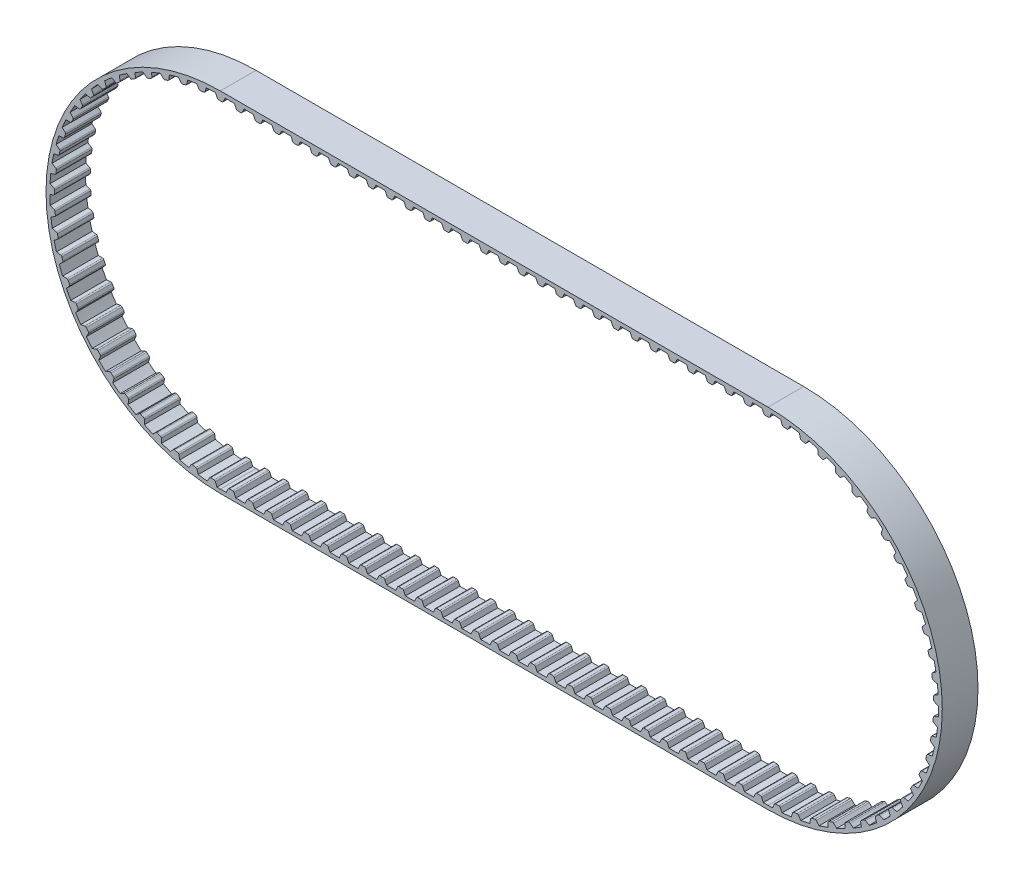
from build123d import *

# Parameters (mm, degrees)
BOSS_EXTRUDE1_DEPTH      = 4.7625
BOSS_EXTRUDE1_DEPTH_BACK = 4.7625
BOSS_EXTRUDE2_DEPTH      = 4.7625
FILLET1_R                = 0.396875
CRVPATTERN1_START        = -4.7625
CRVPATTERN1_DEPTH        = 9.525


# Read off the part's stored shape, not the designer's step: CrvPattern1
with BuildPart() as part:
    # Sketch4 → Boss-Extrude1 (new, two sides: drawn at the far end of the back side and taken through both)
    with BuildSketch(Plane.XY.offset(-BOSS_EXTRUDE1_DEPTH_BACK)):
        with BuildLine():
            Line((-73.025, -46.489158877), (73.025, -46.489158877))
            ThreePointArc((73.025, -46.489158877), (119.514158877, 0), (73.025, 46.489158877))
            Line((73.025, 46.489158877), (-73.025, 46.489158877))
            ThreePointArc((-73.025, 46.489158877), (-119.514158877, 0), (-73.025, -46.489158877))
        make_face()
        with BuildLine():
            Line((-73.025, -45.473158877), (73.025, -45.473158877))
            ThreePointArc((73.025, -45.473158877), (118.498158877, 0), (73.025, 45.473158877))
            Line((73.025, 45.473158877), (-73.025, 45.473158877))
            ThreePointArc((-73.025, 45.473158877), (-118.498158877, 0), (-73.025, -45.473158877))
        make_face(mode=Mode.SUBTRACT)
    extrude(amount=BOSS_EXTRUDE1_DEPTH + BOSS_EXTRUDE1_DEPTH_BACK)

    # Sketch5 → Boss-Extrude2 (add, symmetric)
    with BuildSketch(Plane.XY):
        Polygon((-74.3077, 45.473158877), (-73.715489274, 44.203158877), (-72.334510726, 44.203158877), (-71.7423, 45.473158877), align=None)
    extrude(amount=BOSS_EXTRUDE2_DEPTH, both=True)

    # Fillet1
    fillet1_edges = [part.edges().sort_by_distance(p)[0] for p in [
        (-73.715489274, 44.203158877, 0),
        (-72.334510726, 44.203158877, 0),
    ]]
    fillet(fillet1_edges, radius=FILLET1_R)

    # CrvPattern1 outline → CrvPattern1 (add)
    with BuildSketch(Plane.XY.offset(CRVPATTERN1_START)):
        with BuildLine():
            Line((-67.203167659, 44.432307255), (-66.717810576, 45.473158877))
            Line((-66.717810576, 45.473158877), (-69.283210576, 45.473158877))
            Line((-69.283210576, 45.473158877), (-68.797853494, 44.432307255))
            ThreePointArc((-68.797853494, 44.432307255), (-68.651403373, 44.265312897), (-68.438162591, 44.203158877))
            Line((-68.438162591, 44.203158877), (-67.562858562, 44.203158877))
            ThreePointArc((-67.562858562, 44.203158877), (-67.34961778, 44.265312897), (-67.203167659, 44.432307255))
        make_face()
        with BuildLine():
            Line((-62.178678235, 44.432307255), (-61.693321153, 45.473158877))
            Line((-61.693321153, 45.473158877), (-64.258721153, 45.473158877))
            Line((-64.258721153, 45.473158877), (-63.77336407, 44.432307255))
            ThreePointArc((-63.77336407, 44.432307255), (-63.626913949, 44.265312897), (-63.413673167, 44.203158877))
            Line((-63.413673167, 44.203158877), (-62.538369138, 44.203158877))
            ThreePointArc((-62.538369138, 44.203158877), (-62.325128356, 44.265312897), (-62.178678235, 44.432307255))
        make_face()
        with BuildLine():
            Line((-57.154188811, 44.432307255), (-56.668831729, 45.473158877))
            Line((-56.668831729, 45.473158877), (-59.234231729, 45.473158877))
            Line((-59.234231729, 45.473158877), (-58.748874646, 44.432307255))
            ThreePointArc((-58.748874646, 44.432307255), (-58.602424525, 44.265312897), (-58.389183743, 44.203158877))
            Line((-58.389183743, 44.203158877), (-57.513879714, 44.203158877))
            ThreePointArc((-57.513879714, 44.203158877), (-57.300638932, 44.265312897), (-57.154188811, 44.432307255))
        make_face()
        with BuildLine():
            Line((-52.129699388, 44.432307255), (-51.644342305, 45.473158877))
            Line((-51.644342305, 45.473158877), (-54.209742305, 45.473158877))
            Line((-54.209742305, 45.473158877), (-53.724385222, 44.432307255))
            ThreePointArc((-53.724385222, 44.432307255), (-53.577935102, 44.265312897), (-53.36469432, 44.203158877))
            Line((-53.36469432, 44.203158877), (-52.489390291, 44.203158877))
            ThreePointArc((-52.489390291, 44.203158877), (-52.276149509, 44.265312897), (-52.129699388, 44.432307255))
        make_face()
        with BuildLine():
            Line((-47.105209964, 44.432307255), (-46.619852881, 45.473158877))
            Line((-46.619852881, 45.473158877), (-49.185252881, 45.473158877))
            Line((-49.185252881, 45.473158877), (-48.699895799, 44.432307255))
            ThreePointArc((-48.699895799, 44.432307255), (-48.553445678, 44.265312897), (-48.340204896, 44.203158877))
            Line((-48.340204896, 44.203158877), (-47.464900867, 44.203158877))
            ThreePointArc((-47.464900867, 44.203158877), (-47.251660085, 44.265312897), (-47.105209964, 44.432307255))
        make_face()
        with BuildLine():
            Line((-42.08072054, 44.432307255), (-41.595363458, 45.473158877))
            Line((-41.595363458, 45.473158877), (-44.160763458, 45.473158877))
            Line((-44.160763458, 45.473158877), (-43.675406375, 44.432307255))
            ThreePointArc((-43.675406375, 44.432307255), (-43.528956254, 44.265312897), (-43.315715472, 44.203158877))
            Line((-43.315715472, 44.203158877), (-42.440411443, 44.203158877))
            ThreePointArc((-42.440411443, 44.203158877), (-42.227170661, 44.265312897), (-42.08072054, 44.432307255))
        make_face()
        with BuildLine():
            Line((-37.056231117, 44.432307255), (-36.570874034, 45.473158877))
            Line((-36.570874034, 45.473158877), (-39.136274034, 45.473158877))
            Line((-39.136274034, 45.473158877), (-38.650916951, 44.432307255))
            ThreePointArc((-38.650916951, 44.432307255), (-38.50446683, 44.265312897), (-38.291226048, 44.203158877))
            Line((-38.291226048, 44.203158877), (-37.41592202, 44.203158877))
            ThreePointArc((-37.41592202, 44.203158877), (-37.202681238, 44.265312897), (-37.056231117, 44.432307255))
        make_face()
        with BuildLine():
            Line((-32.031741693, 44.432307255), (-31.54638461, 45.473158877))
            Line((-31.54638461, 45.473158877), (-34.11178461, 45.473158877))
            Line((-34.11178461, 45.473158877), (-33.626427528, 44.432307255))
            ThreePointArc((-33.626427528, 44.432307255), (-33.479977407, 44.265312897), (-33.266736625, 44.203158877))
            Line((-33.266736625, 44.203158877), (-32.391432596, 44.203158877))
            ThreePointArc((-32.391432596, 44.203158877), (-32.178191814, 44.265312897), (-32.031741693, 44.432307255))
        make_face()
        with BuildLine():
            Line((-27.007252269, 44.432307255), (-26.521895187, 45.473158877))
            Line((-26.521895187, 45.473158877), (-29.087295187, 45.473158877))
            Line((-29.087295187, 45.473158877), (-28.601938104, 44.432307255))
            ThreePointArc((-28.601938104, 44.432307255), (-28.455487983, 44.265312897), (-28.242247201, 44.203158877))
            Line((-28.242247201, 44.203158877), (-27.366943172, 44.203158877))
            ThreePointArc((-27.366943172, 44.203158877), (-27.15370239, 44.265312897), (-27.007252269, 44.432307255))
        make_face()
        with BuildLine():
            Line((-21.982762845, 44.432307255), (-21.497405763, 45.473158877))
            Line((-21.497405763, 45.473158877), (-24.062805763, 45.473158877))
            Line((-24.062805763, 45.473158877), (-23.57744868, 44.432307255))
            ThreePointArc((-23.57744868, 44.432307255), (-23.430998559, 44.265312897), (-23.217757777, 44.203158877))
            Line((-23.217757777, 44.203158877), (-22.342453748, 44.203158877))
            ThreePointArc((-22.342453748, 44.203158877), (-22.129212966, 44.265312897), (-21.982762845, 44.432307255))
        make_face()
        with BuildLine():
            Line((-16.958273422, 44.432307255), (-16.472916339, 45.473158877))
            Line((-16.472916339, 45.473158877), (-19.038316339, 45.473158877))
            Line((-19.038316339, 45.473158877), (-18.552959256, 44.432307255))
            ThreePointArc((-18.552959256, 44.432307255), (-18.406509136, 44.265312897), (-18.193268353, 44.203158877))
            Line((-18.193268353, 44.203158877), (-17.317964325, 44.203158877))
            ThreePointArc((-17.317964325, 44.203158877), (-17.104723543, 44.265312897), (-16.958273422, 44.432307255))
        make_face()
        with BuildLine():
            Line((-11.933783998, 44.432307255), (-11.448426915, 45.473158877))
            Line((-11.448426915, 45.473158877), (-14.013826915, 45.473158877))
            Line((-14.013826915, 45.473158877), (-13.528469833, 44.432307255))
            ThreePointArc((-13.528469833, 44.432307255), (-13.382019712, 44.265312897), (-13.16877893, 44.203158877))
            Line((-13.16877893, 44.203158877), (-12.293474901, 44.203158877))
            ThreePointArc((-12.293474901, 44.203158877), (-12.080234119, 44.265312897), (-11.933783998, 44.432307255))
        make_face()
        with BuildLine():
            Line((-6.909294574, 44.432307255), (-6.423937492, 45.473158877))
            Line((-6.423937492, 45.473158877), (-8.989337492, 45.473158877))
            Line((-8.989337492, 45.473158877), (-8.503980409, 44.432307255))
            ThreePointArc((-8.503980409, 44.432307255), (-8.357530288, 44.265312897), (-8.144289506, 44.203158877))
            Line((-8.144289506, 44.203158877), (-7.268985477, 44.203158877))
            ThreePointArc((-7.268985477, 44.203158877), (-7.055744695, 44.265312897), (-6.909294574, 44.432307255))
        make_face()
        with BuildLine():
            Line((-1.884805151, 44.432307255), (-1.399448068, 45.473158877))
            Line((-1.399448068, 45.473158877), (-3.964848068, 45.473158877))
            Line((-3.964848068, 45.473158877), (-3.479490985, 44.432307255))
            ThreePointArc((-3.479490985, 44.432307255), (-3.333040864, 44.265312897), (-3.119800082, 44.203158877))
            Line((-3.119800082, 44.203158877), (-2.244496054, 44.203158877))
            ThreePointArc((-2.244496054, 44.203158877), (-2.031255271, 44.265312897), (-1.884805151, 44.432307255))
        make_face()
        with BuildLine():
            Line((3.139684273, 44.432307255), (3.625041356, 45.473158877))
            Line((3.625041356, 45.473158877), (1.059641356, 45.473158877))
            Line((1.059641356, 45.473158877), (1.544998438, 44.432307255))
            ThreePointArc((1.544998438, 44.432307255), (1.691448559, 44.265312897), (1.904689341, 44.203158877))
            Line((1.904689341, 44.203158877), (2.77999337, 44.203158877))
            ThreePointArc((2.77999337, 44.203158877), (2.993234152, 44.265312897), (3.139684273, 44.432307255))
        make_face()
        with BuildLine():
            Line((8.164173697, 44.432307255), (8.64953078, 45.473158877))
            Line((8.64953078, 45.473158877), (6.08413078, 45.473158877))
            Line((6.08413078, 45.473158877), (6.569487862, 44.432307255))
            ThreePointArc((6.569487862, 44.432307255), (6.715937983, 44.265312897), (6.929178765, 44.203158877))
            Line((6.929178765, 44.203158877), (7.804482794, 44.203158877))
            ThreePointArc((7.804482794, 44.203158877), (8.017723576, 44.265312897), (8.164173697, 44.432307255))
        make_face()
        with BuildLine():
            Line((13.188663121, 44.432307255), (13.674020203, 45.473158877))
            Line((13.674020203, 45.473158877), (11.108620203, 45.473158877))
            Line((11.108620203, 45.473158877), (11.593977286, 44.432307255))
            ThreePointArc((11.593977286, 44.432307255), (11.740427407, 44.265312897), (11.953668189, 44.203158877))
            Line((11.953668189, 44.203158877), (12.828972218, 44.203158877))
            ThreePointArc((12.828972218, 44.203158877), (13.042213, 44.265312897), (13.188663121, 44.432307255))
        make_face()
        with BuildLine():
            Line((18.213152544, 44.432307255), (18.698509627, 45.473158877))
            Line((18.698509627, 45.473158877), (16.133109627, 45.473158877))
            Line((16.133109627, 45.473158877), (16.61846671, 44.432307255))
            ThreePointArc((16.61846671, 44.432307255), (16.764916831, 44.265312897), (16.978157613, 44.203158877))
            Line((16.978157613, 44.203158877), (17.853461641, 44.203158877))
            ThreePointArc((17.853461641, 44.203158877), (18.066702423, 44.265312897), (18.213152544, 44.432307255))
        make_face()
        with BuildLine():
            Line((23.237641968, 44.432307255), (23.722999051, 45.473158877))
            Line((23.722999051, 45.473158877), (21.157599051, 45.473158877))
            Line((21.157599051, 45.473158877), (21.642956133, 44.432307255))
            ThreePointArc((21.642956133, 44.432307255), (21.789406254, 44.265312897), (22.002647036, 44.203158877))
            Line((22.002647036, 44.203158877), (22.877951065, 44.203158877))
            ThreePointArc((22.877951065, 44.203158877), (23.091191847, 44.265312897), (23.237641968, 44.432307255))
        make_face()
        with BuildLine():
            Line((28.262131392, 44.432307255), (28.747488474, 45.473158877))
            Line((28.747488474, 45.473158877), (26.182088474, 45.473158877))
            Line((26.182088474, 45.473158877), (26.667445557, 44.432307255))
            ThreePointArc((26.667445557, 44.432307255), (26.813895678, 44.265312897), (27.02713646, 44.203158877))
            Line((27.02713646, 44.203158877), (27.902440489, 44.203158877))
            ThreePointArc((27.902440489, 44.203158877), (28.115681271, 44.265312897), (28.262131392, 44.432307255))
        make_face()
        with BuildLine():
            Line((33.286620816, 44.432307255), (33.771977898, 45.473158877))
            Line((33.771977898, 45.473158877), (31.206577898, 45.473158877))
            Line((31.206577898, 45.473158877), (31.691934981, 44.432307255))
            ThreePointArc((31.691934981, 44.432307255), (31.838385102, 44.265312897), (32.051625884, 44.203158877))
            Line((32.051625884, 44.203158877), (32.926929913, 44.203158877))
            ThreePointArc((32.926929913, 44.203158877), (33.140170695, 44.265312897), (33.286620816, 44.432307255))
        make_face()
        with BuildLine():
            Line((38.311110239, 44.432307255), (38.796467322, 45.473158877))
            Line((38.796467322, 45.473158877), (36.231067322, 45.473158877))
            Line((36.231067322, 45.473158877), (36.716424404, 44.432307255))
            ThreePointArc((36.716424404, 44.432307255), (36.862874525, 44.265312897), (37.076115307, 44.203158877))
            Line((37.076115307, 44.203158877), (37.951419336, 44.203158877))
            ThreePointArc((37.951419336, 44.203158877), (38.164660118, 44.265312897), (38.311110239, 44.432307255))
        make_face()
        with BuildLine():
            Line((43.335599663, 44.432307255), (43.820956746, 45.473158877))
            Line((43.820956746, 45.473158877), (41.255556746, 45.473158877))
            Line((41.255556746, 45.473158877), (41.740913828, 44.432307255))
            ThreePointArc((41.740913828, 44.432307255), (41.887363949, 44.265312897), (42.100604731, 44.203158877))
            Line((42.100604731, 44.203158877), (42.97590876, 44.203158877))
            ThreePointArc((42.97590876, 44.203158877), (43.189149542, 44.265312897), (43.335599663, 44.432307255))
        make_face()
        with BuildLine():
            Line((48.360089087, 44.432307255), (48.845446169, 45.473158877))
            Line((48.845446169, 45.473158877), (46.280046169, 45.473158877))
            Line((46.280046169, 45.473158877), (46.765403252, 44.432307255))
            ThreePointArc((46.765403252, 44.432307255), (46.911853373, 44.265312897), (47.125094155, 44.203158877))
            Line((47.125094155, 44.203158877), (48.000398184, 44.203158877))
            ThreePointArc((48.000398184, 44.203158877), (48.213638966, 44.265312897), (48.360089087, 44.432307255))
        make_face()
        with BuildLine():
            Line((53.38457851, 44.432307255), (53.869935593, 45.473158877))
            Line((53.869935593, 45.473158877), (51.304535593, 45.473158877))
            Line((51.304535593, 45.473158877), (51.789892676, 44.432307255))
            ThreePointArc((51.789892676, 44.432307255), (51.936342797, 44.265312897), (52.149583579, 44.203158877))
            Line((52.149583579, 44.203158877), (53.024887607, 44.203158877))
            ThreePointArc((53.024887607, 44.203158877), (53.238128389, 44.265312897), (53.38457851, 44.432307255))
        make_face()
        with BuildLine():
            Line((58.409067934, 44.432307255), (58.894425017, 45.473158877))
            Line((58.894425017, 45.473158877), (56.329025017, 45.473158877))
            Line((56.329025017, 45.473158877), (56.814382099, 44.432307255))
            ThreePointArc((56.814382099, 44.432307255), (56.96083222, 44.265312897), (57.174073002, 44.203158877))
            Line((57.174073002, 44.203158877), (58.049377031, 44.203158877))
            ThreePointArc((58.049377031, 44.203158877), (58.262617813, 44.265312897), (58.409067934, 44.432307255))
        make_face()
        with BuildLine():
            Line((63.433557358, 44.432307255), (63.91891444, 45.473158877))
            Line((63.91891444, 45.473158877), (61.35351444, 45.473158877))
            Line((61.35351444, 45.473158877), (61.838871523, 44.432307255))
            ThreePointArc((61.838871523, 44.432307255), (61.985321644, 44.265312897), (62.198562426, 44.203158877))
            Line((62.198562426, 44.203158877), (63.073866455, 44.203158877))
            ThreePointArc((63.073866455, 44.203158877), (63.287107237, 44.265312897), (63.433557358, 44.432307255))
        make_face()
        with BuildLine():
            Line((68.458046782, 44.432307255), (68.943403864, 45.473158877))
            Line((68.943403864, 45.473158877), (66.378003864, 45.473158877))
            Line((66.378003864, 45.473158877), (66.863360947, 44.432307255))
            ThreePointArc((66.863360947, 44.432307255), (67.009811068, 44.265312897), (67.22305185, 44.203158877))
            Line((67.22305185, 44.203158877), (68.098355879, 44.203158877))
            ThreePointArc((68.098355879, 44.203158877), (68.311596661, 44.265312897), (68.458046782, 44.432307255))
        make_face()
        with BuildLine():
            ThreePointArc((-76.770702203, 45.318626339), (-78.039271817, 45.195854416), (-79.30390253, 45.037579434))
            Line((-79.30390253, 45.037579434), (-78.716978891, 44.073428049))
            ThreePointArc((-78.716978891, 44.073428049), (-78.553007581, 43.92360094), (-78.334213533, 43.885339758))
            Line((-78.334213533, 43.885339758), (-77.464247284, 43.981858505))
            ThreePointArc((-77.464247284, 43.981858505), (-77.259160538, 44.067147308), (-77.132017771, 44.249272183))
            Line((-77.132017771, 44.249272183), (-76.770702203, 45.318626339))
        make_face()
        with BuildLine():
            ThreePointArc((-81.745091853, 44.629230067), (-82.992387559, 44.36732315), (-84.231853503, 44.070564017))
            Line((-84.231853503, 44.070564017), (-83.542193202, 43.177011601))
            ThreePointArc((-83.542193202, 43.177011601), (-83.362700562, 43.046179092), (-83.141021749, 43.032277397))
            Line((-83.141021749, 43.032277397), (-82.287003738, 43.22413771))
            ThreePointArc((-82.287003738, 43.22413771), (-82.092572348, 43.331521079), (-81.98628762, 43.526555204))
            Line((-81.98628762, 43.526555204), (-81.745091853, 44.629230067))
        make_face()
        with BuildLine():
            ThreePointArc((-86.613127759, 43.395517767), (-87.823937037, 42.997670179), (-89.023121188, 42.566046289))
            Line((-89.023121188, 42.566046289), (-88.239135598, 41.753990967))
            ThreePointArc((-88.239135598, 41.753990967), (-88.046310794, 41.643748743), (-87.824450899, 41.654376086))
            Line((-87.824450899, 41.654376086), (-86.996797073, 41.939237959))
            ThreePointArc((-86.996797073, 41.939237959), (-86.815392402, 42.067406203), (-86.731262003, 42.272970863))
            Line((-86.731262003, 42.272970863), (-86.613127759, 43.395517767))
        make_face()
        with BuildLine():
            ThreePointArc((-91.315437397, 41.632536292), (-92.47499273, 41.103600342), (-93.619269356, 40.542375953))
            Line((-93.619269356, 40.542375953), (-92.750520282, 39.821721878))
            ThreePointArc((-92.750520282, 39.821721878), (-92.546715081, 39.733414497), (-92.327379997, 39.768441263))
            Line((-92.327379997, 39.768441263), (-91.536184754, 40.142830406))
            ThreePointArc((-91.536184754, 40.142830406), (-91.370019288, 40.290220335), (-91.309069306, 40.50380838))
            Line((-91.309069306, 40.50380838), (-91.315437397, 41.632536292))
        make_face()
        with BuildLine():
            ThreePointArc((-95.79466951, 39.361787671), (-96.888828496, 38.708214474), (-97.964241539, 38.024234505))
            Line((-97.964241539, 38.024234505), (-97.021324592, 37.403771063))
            ThreePointArc((-97.021324592, 37.403771063), (-96.809024685, 37.338475559), (-96.594889511, 37.397474546))
            Line((-96.594889511, 37.397474546), (-95.849802587, 37.85682476))
            ThreePointArc((-95.849802587, 37.85682476), (-95.700902945, 38.021638746), (-95.663876752, 38.240645171))
            Line((-95.663876752, 38.240645171), (-95.79466951, 39.361787671))
        make_face()
        with BuildLine():
            ThreePointArc((-99.996193582, 36.610966868), (-101.011611417, 35.840727666), (-102.005044708, 35.042334212))
            Line((-102.005044708, 35.042334212), (-100.999460083, 34.529628824))
            ThreePointArc((-100.999460083, 34.529628824), (-100.781254765, 34.488141566), (-100.574931179, 34.5703932))
            Line((-100.574931179, 34.5703932), (-99.885039954, 35.109102063))
            ThreePointArc((-99.885039954, 35.109102063), (-99.755222177, 35.289329969), (-99.742571358, 35.511083684))
            Line((-99.742571358, 35.511083684), (-99.996193582, 36.610966868))
        make_face()
        with BuildLine():
            ThreePointArc((-103.868766137, 33.413623999), (-104.793058378, 32.536112938), (-105.692395604, 31.633043526))
            Line((-105.692395604, 31.633043526), (-104.636407816, 31.234349354))
            ThreePointArc((-104.636407816, 31.234349354), (-104.414958407, 31.217176338), (-104.218962815, 31.321677444))
            Line((-104.218962815, 31.321677444), (-103.592681478, 31.933174648))
            ThreePointArc((-103.592681478, 31.933174648), (-103.483528875, 32.126618342), (-103.495407725, 32.348414749))
            Line((-103.495407725, 32.348414749), (-103.868766137, 33.413623999))
        make_face()
        with BuildLine():
            ThreePointArc((-107.365155723, 29.808755143), (-108.187049331, 28.834674701), (-108.981321815, 27.837943527))
            Line((-108.981321815, 27.837943527), (-107.887810114, 27.558123206))
            ThreePointArc((-107.887810114, 27.558123206), (-107.6658175, 27.565473881), (-107.482540342, 27.690949922))
            Line((-107.482540342, 27.690949922), (-106.927507273, 28.3677774))
            ThreePointArc((-106.927507273, 28.3677774), (-106.840351114, 28.572077565), (-106.876614754, 28.791211546))
            Line((-106.876614754, 28.791211546), (-107.365155723, 29.808755143))
        make_face()
        with BuildLine():
            ThreePointArc((-110.442718969, 25.840326728), (-111.152189798, 24.781557181), (-111.831710273, 23.703320781))
            Line((-111.831710273, 23.703320781), (-110.714011568, 23.545787111))
            ThreePointArc((-110.714011568, 23.545787111), (-110.49418326, 23.577571825), (-110.325859859, 23.722492445))
            Line((-110.325859859, 23.722492445), (-109.848844464, 24.456395337))
            ThreePointArc((-109.848844464, 24.456395337), (-109.78474774, 24.669060246), (-109.844953883, 24.882859155))
            Line((-109.844953883, 24.882859155), (-110.442718969, 25.840326728))
        make_face()
        with BuildLine():
            ThreePointArc((-113.063920676, 21.556739303), (-113.652315735, 20.426193831), (-114.208796496, 19.279602808))
            Line((-114.208796496, 19.279602808), (-113.08054269, 19.246277133))
            ThreePointArc((-113.08054269, 19.246277133), (-112.865559802, 19.302108227), (-112.714243097, 19.464705915))
            Line((-112.714243097, 19.464705915), (-112.321063248, 20.246733248))
            ThreePointArc((-112.321063248, 20.246733248), (-112.280807708, 20.465169154), (-112.364222057, 20.671025414))
            Line((-112.364222057, 20.671025414), (-113.063920676, 21.556739303))
        make_face()
        with BuildLine():
            ThreePointArc((-115.196791614, 17.010237221), (-115.656934601, 15.821704411), (-116.083588584, 14.620743051))
            Line((-116.083588584, 14.620743051), (-114.958540314, 14.712031824))
            ThreePointArc((-114.958540314, 14.712031824), (-114.751024864, 14.791228359), (-114.618560375, 14.96952001))
            Line((-114.618560375, 14.96952001), (-114.314011451, 15.790133863))
            ThreePointArc((-114.314011451, 15.790133863), (-114.298088068, 16.011676634), (-114.403693268, 16.207079538))
            Line((-114.403693268, 16.207079538), (-115.196791614, 17.010237221))
        make_face()
        with BuildLine():
            ThreePointArc((-116.815318432, 12.25627145), (-117.141597257, 11.024247125), (-117.433220821, 9.783562835))
            Line((-117.433220821, 9.783562835), (-116.325099627, 9.998352663))
            ThreePointArc((-116.325099627, 9.998352663), (-116.127582556, 10.099948726), (-116.015585874, 10.291759822))
            Line((-116.015585874, 10.291759822), (-115.803382276, 11.140951659))
            ThreePointArc((-115.803382276, 11.140951659), (-115.811985258, 11.36289927), (-115.938493305, 11.545465607))
            Line((-115.938493305, 11.545465607), (-116.815318432, 12.25627145))
        make_face()
        with BuildLine():
            ThreePointArc((-117.899760927, 7.352823266), (-118.088196163, 6.09233369), (-118.241232549, 4.827058354))
            Line((-118.241232549, 4.827058354), (-117.163553522, 5.162729573))
            ThreePointArc((-117.163553522, 5.162729573), (-116.978443829, 5.285486059), (-116.888280909, 5.488477194))
            Line((-116.888280909, 5.488477194), (-116.771010758, 6.35588993))
            ThreePointArc((-116.771010758, 6.35588993), (-116.80403518, 6.575535419), (-116.94990313, 6.743038537))
            Line((-116.94990313, 6.743038537), (-117.899760927, 7.352823266))
        make_face()
        with BuildLine():
            ThreePointArc((-118.436892802, 2.359697095), (-118.485186217, 1.086115705), (-118.497768931, -0.18831887))
            Line((-118.497768931, -0.18831887), (-117.463675879, 0.264139759))
            ThreePointArc((-117.463675879, 0.264139759), (-117.293231235, 0.406559479), (-117.226001741, 0.618254894))
            Line((-117.226001741, 0.618254894), (-117.20509531, 1.493309214))
            ThreePointArc((-117.20509531, 1.493309214), (-117.262138393, 1.707973697), (-117.425587183, 1.858370659))
            Line((-117.425587183, 1.858370659), (-118.436892802, 2.359697095))
        make_face()
        with BuildLine():
            ThreePointArc((-118.420162981, -2.662208891), (-118.327725569, -3.933348983), (-118.199701147, -5.201399281))
            Line((-118.199701147, -5.201399281), (-117.221806284, -4.63767161))
            ThreePointArc((-117.221806284, -4.63767161), (-117.068105502, -4.477325663), (-117.024629391, -4.259507893))
            Line((-117.024629391, -4.259507893), (-117.100341664, -3.387484502))
            ThreePointArc((-117.100341664, -3.387484502), (-117.180707686, -3.18041916), (-117.359743829, -3.048962655))
            Line((-117.359743829, -3.048962655), (-118.420162981, -2.662208891))
        make_face()
        with BuildLine():
            ThreePointArc((-117.849775507, -7.651645507), (-117.617734673, -8.904840967), (-117.350664552, -10.151041337))
            Line((-117.350664552, -10.151041337), (-116.440894677, -9.482920072))
            ThreePointArc((-116.440894677, -9.482920072), (-116.305812352, -9.306603542), (-116.286619877, -9.085320009))
            Line((-116.286619877, -9.085320009), (-116.458027436, -8.226963095))
            ThreePointArc((-116.458027436, -8.226963095), (-116.560736222, -8.030022346), (-116.753176122, -7.919109594))
            Line((-116.753176122, -7.919109594), (-117.849775507, -7.651645507))
        make_face()
        with BuildLine():
            ThreePointArc((-116.732687056, -12.547759579), (-116.363872862, -13.767725931), (-115.961014338, -14.976877212))
            Line((-115.961014338, -14.976877212), (-115.130465369, -14.21251103))
            ThreePointArc((-115.130465369, -14.21251103), (-115.015649019, -14.022374344), (-115.020974259, -13.80032391))
            Line((-115.020974259, -13.80032391), (-115.285986549, -12.96610234))
            ThreePointArc((-115.285986549, -12.96610234), (-115.409785422, -12.781688152), (-115.613282003, -12.69267189))
            Line((-115.613282003, -12.69267189), (-116.732687056, -12.547759579))
        make_face()
        with BuildLine():
            ThreePointArc((-115.082522087, -17.290836132), (-114.581432739, -18.462694176), (-114.047699236, -19.620049074))
            Line((-114.047699236, -19.620049074), (-113.306500882, -18.768760491))
            ThreePointArc((-113.306500882, -18.768760491), (-113.213350855, -18.567122633), (-113.243128861, -18.347013515))
            Line((-113.243128861, -18.347013515), (-113.598513686, -17.547101789))
            ThreePointArc((-113.598513686, -17.547101789), (-113.741892744, -17.377463353), (-113.95396408, -17.311429259))
            Line((-113.95396408, -17.311429259), (-115.082522087, -17.290836132))
        make_face()
        with BuildLine():
            ThreePointArc((-112.919406675, -21.823026699), (-112.292153661, -22.932483983), (-111.634054807, -24.023926931))
            Line((-111.634054807, -24.023926931), (-110.991247022, -23.096098605))
            ThreePointArc((-110.991247022, -23.096098605), (-110.920899412, -22.885418831), (-110.974766999, -22.669935569))
            Line((-110.974766999, -22.669935569), (-111.416189942, -21.914089733))
            ThreePointArc((-111.416189942, -21.914089733), (-111.577400477, -21.761296026), (-111.795460062, -21.719049479))
            Line((-111.795460062, -21.719049479), (-112.919406675, -21.823026699))
        make_face()
        with BuildLine():
            ThreePointArc((-110.269723045, -26.089054861), (-109.523956594, -27.122579998), (-108.749518828, -28.13479932))
            Line((-108.749518828, -28.13479932), (-108.212941553, -27.141747419))
            ThreePointArc((-108.212941553, -27.141747419), (-108.166254348, -26.924595264), (-108.243554527, -26.716365977))
            Line((-108.243554527, -26.716365977), (-108.765631817, -26.01380463))
            ThreePointArc((-108.765631817, -26.01380463), (-108.94270764, -25.879719187), (-109.164095931, -25.861775442))
            Line((-109.164095931, -25.861775442), (-110.269723045, -26.089054861))
        make_face()
        with BuildLine():
            ThreePointArc((-107.165787805, -30.036890424), (-106.310603584, -30.981878127), (-105.429272258, -31.902528389))
            Line((-105.429272258, -31.902528389), (-105.005469807, -30.856364572))
            ThreePointArc((-105.005469807, -30.856364572), (-104.983012423, -30.635388511), (-105.082802409, -30.436952849))
            Line((-105.082802409, -30.436952849), (-105.679166581, -29.796244712))
            ThreePointArc((-105.679166581, -29.796244712), (-105.869948004, -29.682502891), (-106.091964861, -29.689080797))
            Line((-106.091964861, -29.689080797), (-107.165787805, -30.036890424))
        make_face()
        with BuildLine():
            ThreePointArc((-103.645457794, -33.618384), (-102.691285975, -34.463308818), (-101.713810162, -35.2811614))
            Line((-101.713810162, -35.2811614), (-101.407951398, -34.194645101))
            ThreePointArc((-101.407951398, -34.194645101), (-101.409997735, -33.972540248), (-101.531060448, -33.786318411))
            Line((-101.531060448, -33.786318411), (-102.194438005, -33.215277817))
            ThreePointArc((-102.194438005, -33.215277817), (-102.396598182, -33.123266861), (-102.616535797, -33.154286191))
            Line((-102.616535797, -33.154286191), (-103.645457794, -33.618384))
        make_face()
        with BuildLine():
            ThreePointArc((-99.751668373, -36.789854253), (-98.710146418, -37.524411144), (-97.648447806, -38.229491187))
            Line((-97.648447806, -38.229491187), (-97.464263107, -37.115873996))
            ThreePointArc((-97.464263107, -37.115873996), (-97.490788205, -36.89534923), (-97.631647117, -36.723612454))
            Line((-97.631647117, -36.723612454), (-98.35394724, -36.229204045))
            ThreePointArc((-98.35394724, -36.229204045), (-98.565020544, -36.160046155), (-98.78019647, -36.215128586))
            Line((-98.78019647, -36.215128586), (-99.751668373, -36.789854253))
        make_face()
        with BuildLine():
            ThreePointArc((-95.531909764, -39.512620656), (-94.415740493, -40.12785067), (-93.282767984, -40.711558734))
            Line((-93.282767984, -40.711558734), (-93.22250374, -39.584422774))
            ThreePointArc((-93.22250374, -39.584422774), (-93.27318409, -39.368167704), (-93.432121228, -39.21301056))
            Line((-93.432121228, -39.21301056), (-94.204534455, -38.801264339))
            ThreePointArc((-94.204534455, -38.801264339), (-94.42194655, -38.755802993), (-94.629736415, -38.834276717))
            Line((-94.629736415, -38.834276717), (-95.531909764, -39.512620656))
        make_face()
        with BuildLine():
            ThreePointArc((-91.037647837, -41.753475258), (-89.8604445, -42.241874801), (-88.670016282, -42.697091749))
            Line((-88.670016282, -42.697091749), (-88.734407499, -41.570184023))
            ThreePointArc((-88.734407499, -41.570184023), (-88.808624983, -41.360836182), (-88.983701887, -41.224151029))
            Line((-88.983701887, -41.224151029), (-89.796807555, -40.900088818))
            ThreePointArc((-89.796807555, -40.900088818), (-90.017906797, -40.878878481), (-90.215776312, -40.979786401))
            Line((-90.215776312, -40.979786401), (-91.037647837, -41.753475258))
        make_face()
        with BuildLine():
            ThreePointArc((-86.323696417, -43.485087695), (-85.099816659, -43.84070005), (-83.866451674, -44.161873872))
            Line((-83.866451674, -44.161873872), (-84.054713012, -43.0489386))
            ThreePointArc((-84.054713012, -43.0489386), (-84.151562443, -42.849051279), (-84.340643804, -42.732505184))
            Line((-84.340643804, -42.732505184), (-85.184524949, -42.500079377))
            ThreePointArc((-85.184524949, -42.500079377), (-85.406614723, -42.503378738), (-85.592150592, -42.62549014))
            Line((-85.592150592, -42.62549014), (-86.323696417, -43.485087695))
        make_face()
        with BuildLine():
            ThreePointArc((-81.447548751, -44.686338525), (-80.191919501, -44.904826501), (-78.930660363, -45.088040032))
            Line((-78.930660363, -45.088040032), (-79.240495711, -44.00265102))
            ThreePointArc((-79.240495711, -44.00265102), (-79.358795875, -43.814662125), (-79.559575581, -43.719676531))
            Line((-79.559575581, -43.719676531), (-80.42393989, -43.581721886))
            ThreePointArc((-80.42393989, -43.581721886), (-80.644311499, -43.609490706), (-80.815250852, -43.75131627))
            Line((-80.815250852, -43.75131627), (-81.447548751, -44.686338525))
        make_face()
        with BuildLine():
            ThreePointArc((-76.468676296, -45.342576811), (-75.196611713, -45.421275641), (-73.922841246, -45.464294335))
            Line((-73.922841246, -45.464294335), (-74.350471727, -44.419689422))
            ThreePointArc((-74.350471727, -44.419689422), (-74.488779787, -44.245891742), (-74.698809048, -44.173625132))
            Line((-74.698809048, -44.173625132), (-75.573114386, -44.131824198))
            ThreePointArc((-75.573114386, -44.131824198), (-75.789080089, -44.183723797), (-75.943338082, -44.343533762))
            Line((-75.943338082, -44.343533762), (-76.468676296, -45.342576811))
        make_face()
        with BuildLine():
            Line((-71.455648576, -45.473158877), (-68.890248576, -45.473158877))
            Line((-68.890248576, -45.473158877), (-69.375605659, -44.432307255))
            ThreePointArc((-69.375605659, -44.432307255), (-69.52205578, -44.265312897), (-69.735296562, -44.203158877))
            Line((-69.735296562, -44.203158877), (-70.61060059, -44.203158877))
            ThreePointArc((-70.61060059, -44.203158877), (-70.823841372, -44.265312897), (-70.970291493, -44.432307255))
            Line((-70.970291493, -44.432307255), (-71.455648576, -45.473158877))
        make_face()
        with BuildLine():
            Line((-66.431159152, -45.473158877), (-63.865759152, -45.473158877))
            Line((-63.865759152, -45.473158877), (-64.351116235, -44.432307255))
            ThreePointArc((-64.351116235, -44.432307255), (-64.497566356, -44.265312897), (-64.710807138, -44.203158877))
            Line((-64.710807138, -44.203158877), (-65.586111167, -44.203158877))
            ThreePointArc((-65.586111167, -44.203158877), (-65.799351949, -44.265312897), (-65.94580207, -44.432307255))
            Line((-65.94580207, -44.432307255), (-66.431159152, -45.473158877))
        make_face()
        with BuildLine():
            Line((-61.406669729, -45.473158877), (-58.841269729, -45.473158877))
            Line((-58.841269729, -45.473158877), (-59.326626811, -44.432307255))
            ThreePointArc((-59.326626811, -44.432307255), (-59.473076932, -44.265312897), (-59.686317714, -44.203158877))
            Line((-59.686317714, -44.203158877), (-60.561621743, -44.203158877))
            ThreePointArc((-60.561621743, -44.203158877), (-60.774862525, -44.265312897), (-60.921312646, -44.432307255))
            Line((-60.921312646, -44.432307255), (-61.406669729, -45.473158877))
        make_face()
        with BuildLine():
            Line((-56.382180305, -45.473158877), (-53.816780305, -45.473158877))
            Line((-53.816780305, -45.473158877), (-54.302137388, -44.432307255))
            ThreePointArc((-54.302137388, -44.432307255), (-54.448587508, -44.265312897), (-54.66182829, -44.203158877))
            Line((-54.66182829, -44.203158877), (-55.537132319, -44.203158877))
            ThreePointArc((-55.537132319, -44.203158877), (-55.750373101, -44.265312897), (-55.896823222, -44.432307255))
            Line((-55.896823222, -44.432307255), (-56.382180305, -45.473158877))
        make_face()
        with BuildLine():
            Line((-51.357690881, -45.473158877), (-48.792290881, -45.473158877))
            Line((-48.792290881, -45.473158877), (-49.277647964, -44.432307255))
            ThreePointArc((-49.277647964, -44.432307255), (-49.424098085, -44.265312897), (-49.637338867, -44.203158877))
            Line((-49.637338867, -44.203158877), (-50.512642896, -44.203158877))
            ThreePointArc((-50.512642896, -44.203158877), (-50.725883678, -44.265312897), (-50.872333799, -44.432307255))
            Line((-50.872333799, -44.432307255), (-51.357690881, -45.473158877))
        make_face()
        with BuildLine():
            Line((-46.333201457, -45.473158877), (-43.767801457, -45.473158877))
            Line((-43.767801457, -45.473158877), (-44.25315854, -44.432307255))
            ThreePointArc((-44.25315854, -44.432307255), (-44.399608661, -44.265312897), (-44.612849443, -44.203158877))
            Line((-44.612849443, -44.203158877), (-45.488153472, -44.203158877))
            ThreePointArc((-45.488153472, -44.203158877), (-45.701394254, -44.265312897), (-45.847844375, -44.432307255))
            Line((-45.847844375, -44.432307255), (-46.333201457, -45.473158877))
        make_face()
        with BuildLine():
            Line((-41.308712034, -45.473158877), (-38.743312034, -45.473158877))
            Line((-38.743312034, -45.473158877), (-39.228669116, -44.432307255))
            ThreePointArc((-39.228669116, -44.432307255), (-39.375119237, -44.265312897), (-39.588360019, -44.203158877))
            Line((-39.588360019, -44.203158877), (-40.463664048, -44.203158877))
            ThreePointArc((-40.463664048, -44.203158877), (-40.67690483, -44.265312897), (-40.823354951, -44.432307255))
            Line((-40.823354951, -44.432307255), (-41.308712034, -45.473158877))
        make_face()
        with BuildLine():
            Line((-36.28422261, -45.473158877), (-33.71882261, -45.473158877))
            Line((-33.71882261, -45.473158877), (-34.204179693, -44.432307255))
            ThreePointArc((-34.204179693, -44.432307255), (-34.350629814, -44.265312897), (-34.563870596, -44.203158877))
            Line((-34.563870596, -44.203158877), (-35.439174624, -44.203158877))
            ThreePointArc((-35.439174624, -44.203158877), (-35.652415406, -44.265312897), (-35.798865527, -44.432307255))
            Line((-35.798865527, -44.432307255), (-36.28422261, -45.473158877))
        make_face()
        with BuildLine():
            Line((-31.259733186, -45.473158877), (-28.694333186, -45.473158877))
            Line((-28.694333186, -45.473158877), (-29.179690269, -44.432307255))
            ThreePointArc((-29.179690269, -44.432307255), (-29.32614039, -44.265312897), (-29.539381172, -44.203158877))
            Line((-29.539381172, -44.203158877), (-30.414685201, -44.203158877))
            ThreePointArc((-30.414685201, -44.203158877), (-30.627925983, -44.265312897), (-30.774376104, -44.432307255))
            Line((-30.774376104, -44.432307255), (-31.259733186, -45.473158877))
        make_face()
        with BuildLine():
            Line((-26.235243763, -45.473158877), (-23.669843763, -45.473158877))
            Line((-23.669843763, -45.473158877), (-24.155200845, -44.432307255))
            ThreePointArc((-24.155200845, -44.432307255), (-24.301650966, -44.265312897), (-24.514891748, -44.203158877))
            Line((-24.514891748, -44.203158877), (-25.390195777, -44.203158877))
            ThreePointArc((-25.390195777, -44.203158877), (-25.603436559, -44.265312897), (-25.74988668, -44.432307255))
            Line((-25.74988668, -44.432307255), (-26.235243763, -45.473158877))
        make_face()
        with BuildLine():
            Line((-21.210754339, -45.473158877), (-18.645354339, -45.473158877))
            Line((-18.645354339, -45.473158877), (-19.130711421, -44.432307255))
            ThreePointArc((-19.130711421, -44.432307255), (-19.277161542, -44.265312897), (-19.490402324, -44.203158877))
            Line((-19.490402324, -44.203158877), (-20.365706353, -44.203158877))
            ThreePointArc((-20.365706353, -44.203158877), (-20.578947135, -44.265312897), (-20.725397256, -44.432307255))
            Line((-20.725397256, -44.432307255), (-21.210754339, -45.473158877))
        make_face()
        with BuildLine():
            Line((-16.186264915, -45.473158877), (-13.620864915, -45.473158877))
            Line((-13.620864915, -45.473158877), (-14.106221998, -44.432307255))
            ThreePointArc((-14.106221998, -44.432307255), (-14.252672119, -44.265312897), (-14.465912901, -44.203158877))
            Line((-14.465912901, -44.203158877), (-15.34121693, -44.203158877))
            ThreePointArc((-15.34121693, -44.203158877), (-15.554457712, -44.265312897), (-15.700907832, -44.432307255))
            Line((-15.700907832, -44.432307255), (-16.186264915, -45.473158877))
        make_face()
        with BuildLine():
            Line((-11.161775491, -45.473158877), (-8.596375491, -45.473158877))
            Line((-8.596375491, -45.473158877), (-9.081732574, -44.432307255))
            ThreePointArc((-9.081732574, -44.432307255), (-9.228182695, -44.265312897), (-9.441423477, -44.203158877))
            Line((-9.441423477, -44.203158877), (-10.316727506, -44.203158877))
            ThreePointArc((-10.316727506, -44.203158877), (-10.529968288, -44.265312897), (-10.676418409, -44.432307255))
            Line((-10.676418409, -44.432307255), (-11.161775491, -45.473158877))
        make_face()
        with BuildLine():
            Line((-6.137286068, -45.473158877), (-3.571886068, -45.473158877))
            Line((-3.571886068, -45.473158877), (-4.05724315, -44.432307255))
            ThreePointArc((-4.05724315, -44.432307255), (-4.203693271, -44.265312897), (-4.416934053, -44.203158877))
            Line((-4.416934053, -44.203158877), (-5.292238082, -44.203158877))
            ThreePointArc((-5.292238082, -44.203158877), (-5.505478864, -44.265312897), (-5.651928985, -44.432307255))
            Line((-5.651928985, -44.432307255), (-6.137286068, -45.473158877))
        make_face()
        with BuildLine():
            Line((-1.112796644, -45.473158877), (1.452603356, -45.473158877))
            Line((1.452603356, -45.473158877), (0.967246273, -44.432307255))
            ThreePointArc((0.967246273, -44.432307255), (0.820796152, -44.265312897), (0.60755537, -44.203158877))
            Line((0.60755537, -44.203158877), (-0.267748658, -44.203158877))
            ThreePointArc((-0.267748658, -44.203158877), (-0.48098944, -44.265312897), (-0.627439561, -44.432307255))
            Line((-0.627439561, -44.432307255), (-1.112796644, -45.473158877))
        make_face()
        with BuildLine():
            Line((3.91169278, -45.473158877), (6.47709278, -45.473158877))
            Line((6.47709278, -45.473158877), (5.991735697, -44.432307255))
            ThreePointArc((5.991735697, -44.432307255), (5.845285576, -44.265312897), (5.632044794, -44.203158877))
            Line((5.632044794, -44.203158877), (4.756740765, -44.203158877))
            ThreePointArc((4.756740765, -44.203158877), (4.543499983, -44.265312897), (4.397049862, -44.432307255))
            Line((4.397049862, -44.432307255), (3.91169278, -45.473158877))
        make_face()
        with BuildLine():
            Line((8.936182203, -45.473158877), (11.501582203, -45.473158877))
            Line((11.501582203, -45.473158877), (11.016225121, -44.432307255))
            ThreePointArc((11.016225121, -44.432307255), (10.869775, -44.265312897), (10.656534218, -44.203158877))
            Line((10.656534218, -44.203158877), (9.781230189, -44.203158877))
            ThreePointArc((9.781230189, -44.203158877), (9.567989407, -44.265312897), (9.421539286, -44.432307255))
            Line((9.421539286, -44.432307255), (8.936182203, -45.473158877))
        make_face()
        with BuildLine():
            Line((13.960671627, -45.473158877), (16.526071627, -45.473158877))
            Line((16.526071627, -45.473158877), (16.040714545, -44.432307255))
            ThreePointArc((16.040714545, -44.432307255), (15.894264424, -44.265312897), (15.681023642, -44.203158877))
            Line((15.681023642, -44.203158877), (14.805719613, -44.203158877))
            ThreePointArc((14.805719613, -44.203158877), (14.592478831, -44.265312897), (14.44602871, -44.432307255))
            Line((14.44602871, -44.432307255), (13.960671627, -45.473158877))
        make_face()
        with BuildLine():
            Line((18.985161051, -45.473158877), (21.550561051, -45.473158877))
            Line((21.550561051, -45.473158877), (21.065203968, -44.432307255))
            ThreePointArc((21.065203968, -44.432307255), (20.918753847, -44.265312897), (20.705513065, -44.203158877))
            Line((20.705513065, -44.203158877), (19.830209037, -44.203158877))
            ThreePointArc((19.830209037, -44.203158877), (19.616968254, -44.265312897), (19.470518134, -44.432307255))
            Line((19.470518134, -44.432307255), (18.985161051, -45.473158877))
        make_face()
        with BuildLine():
            Line((24.009650475, -45.473158877), (26.575050475, -45.473158877))
            Line((26.575050475, -45.473158877), (26.089693392, -44.432307255))
            ThreePointArc((26.089693392, -44.432307255), (25.943243271, -44.265312897), (25.730002489, -44.203158877))
            Line((25.730002489, -44.203158877), (24.85469846, -44.203158877))
            ThreePointArc((24.85469846, -44.203158877), (24.641457678, -44.265312897), (24.495007557, -44.432307255))
            Line((24.495007557, -44.432307255), (24.009650475, -45.473158877))
        make_face()
        with BuildLine():
            Line((29.034139898, -45.473158877), (31.599539898, -45.473158877))
            Line((31.599539898, -45.473158877), (31.114182816, -44.432307255))
            ThreePointArc((31.114182816, -44.432307255), (30.967732695, -44.265312897), (30.754491913, -44.203158877))
            Line((30.754491913, -44.203158877), (29.879187884, -44.203158877))
            ThreePointArc((29.879187884, -44.203158877), (29.665947102, -44.265312897), (29.519496981, -44.432307255))
            Line((29.519496981, -44.432307255), (29.034139898, -45.473158877))
        make_face()
        with BuildLine():
            Line((34.058629322, -45.473158877), (36.624029322, -45.473158877))
            Line((36.624029322, -45.473158877), (36.138672239, -44.432307255))
            ThreePointArc((36.138672239, -44.432307255), (35.992222119, -44.265312897), (35.778981336, -44.203158877))
            Line((35.778981336, -44.203158877), (34.903677308, -44.203158877))
            ThreePointArc((34.903677308, -44.203158877), (34.690436526, -44.265312897), (34.543986405, -44.432307255))
            Line((34.543986405, -44.432307255), (34.058629322, -45.473158877))
        make_face()
        with BuildLine():
            Line((39.083118746, -45.473158877), (41.648518746, -45.473158877))
            Line((41.648518746, -45.473158877), (41.163161663, -44.432307255))
            ThreePointArc((41.163161663, -44.432307255), (41.016711542, -44.265312897), (40.80347076, -44.203158877))
            Line((40.80347076, -44.203158877), (39.928166731, -44.203158877))
            ThreePointArc((39.928166731, -44.203158877), (39.714925949, -44.265312897), (39.568475828, -44.432307255))
            Line((39.568475828, -44.432307255), (39.083118746, -45.473158877))
        make_face()
        with BuildLine():
            Line((44.10760817, -45.473158877), (46.67300817, -45.473158877))
            Line((46.67300817, -45.473158877), (46.187651087, -44.432307255))
            ThreePointArc((46.187651087, -44.432307255), (46.041200966, -44.265312897), (45.827960184, -44.203158877))
            Line((45.827960184, -44.203158877), (44.952656155, -44.203158877))
            ThreePointArc((44.952656155, -44.203158877), (44.739415373, -44.265312897), (44.592965252, -44.432307255))
            Line((44.592965252, -44.432307255), (44.10760817, -45.473158877))
        make_face()
        with BuildLine():
            Line((49.132097593, -45.473158877), (51.697497593, -45.473158877))
            Line((51.697497593, -45.473158877), (51.212140511, -44.432307255))
            ThreePointArc((51.212140511, -44.432307255), (51.06569039, -44.265312897), (50.852449608, -44.203158877))
            Line((50.852449608, -44.203158877), (49.977145579, -44.203158877))
            ThreePointArc((49.977145579, -44.203158877), (49.763904797, -44.265312897), (49.617454676, -44.432307255))
            Line((49.617454676, -44.432307255), (49.132097593, -45.473158877))
        make_face()
        with BuildLine():
            Line((54.156587017, -45.473158877), (56.721987017, -45.473158877))
            Line((56.721987017, -45.473158877), (56.236629934, -44.432307255))
            ThreePointArc((56.236629934, -44.432307255), (56.090179813, -44.265312897), (55.876939031, -44.203158877))
            Line((55.876939031, -44.203158877), (55.001635003, -44.203158877))
            ThreePointArc((55.001635003, -44.203158877), (54.788394221, -44.265312897), (54.6419441, -44.432307255))
            Line((54.6419441, -44.432307255), (54.156587017, -45.473158877))
        make_face()
        with BuildLine():
            Line((59.181076441, -45.473158877), (61.746476441, -45.473158877))
            Line((61.746476441, -45.473158877), (61.261119358, -44.432307255))
            ThreePointArc((61.261119358, -44.432307255), (61.114669237, -44.265312897), (60.901428455, -44.203158877))
            Line((60.901428455, -44.203158877), (60.026124426, -44.203158877))
            ThreePointArc((60.026124426, -44.203158877), (59.812883644, -44.265312897), (59.666433523, -44.432307255))
            Line((59.666433523, -44.432307255), (59.181076441, -45.473158877))
        make_face()
        with BuildLine():
            Line((64.205565864, -45.473158877), (66.770965864, -45.473158877))
            Line((66.770965864, -45.473158877), (66.285608782, -44.432307255))
            ThreePointArc((66.285608782, -44.432307255), (66.139158661, -44.265312897), (65.925917879, -44.203158877))
            Line((65.925917879, -44.203158877), (65.05061385, -44.203158877))
            ThreePointArc((65.05061385, -44.203158877), (64.837373068, -44.265312897), (64.690922947, -44.432307255))
            Line((64.690922947, -44.432307255), (64.205565864, -45.473158877))
        make_face()
        with BuildLine():
            Line((69.230055288, -45.473158877), (71.795455288, -45.473158877))
            Line((71.795455288, -45.473158877), (71.310098206, -44.432307255))
            ThreePointArc((71.310098206, -44.432307255), (71.163648085, -44.265312897), (70.950407303, -44.203158877))
            Line((70.950407303, -44.203158877), (70.075103274, -44.203158877))
            ThreePointArc((70.075103274, -44.203158877), (69.861862492, -44.265312897), (69.715412371, -44.432307255))
            Line((69.715412371, -44.432307255), (69.230055288, -45.473158877))
        make_face()
        with BuildLine():
            ThreePointArc((74.262553486, -45.456315729), (75.535966926, -45.403779835), (76.807407907, -45.31557755))
            Line((76.807407907, -45.31557755), (76.274618894, -44.320488047))
            ThreePointArc((76.274618894, -44.320488047), (76.119171009, -44.161835255), (75.90282351, -44.111550935))
            Line((75.90282351, -44.111550935), (75.028854945, -44.159884051))
            ThreePointArc((75.028854945, -44.159884051), (74.819371569, -44.233718112), (74.682366094, -44.408544463))
            Line((74.682366094, -44.408544463), (74.262553486, -45.456315729))
        make_face()
        with BuildLine():
            ThreePointArc((79.267421178, -45.042650411), (80.527276016, -44.850017088), (81.781237532, -44.622152375))
            Line((81.781237532, -44.622152375), (81.141970223, -43.691881146))
            ThreePointArc((81.141970223, -43.691881146), (80.969975834, -43.551336906), (80.749402872, -43.525215614))
            Line((80.749402872, -43.525215614), (79.886093579, -43.669625473))
            ThreePointArc((79.886093579, -43.669625473), (79.68602927, -43.766108764), (79.569137178, -43.954976422))
            Line((79.569137178, -43.954976422), (79.267421178, -45.042650411))
        make_face()
        with BuildLine():
            ThreePointArc((84.196153793, -44.079626827), (85.427084333, -43.749245507), (86.648272565, -43.384497495))
            Line((86.648272565, -43.384497495), (85.910323721, -42.530390503))
            ThreePointArc((85.910323721, -42.530390503), (85.72388054, -42.409668949), (85.501772312, -42.408029271))
            Line((85.501772312, -42.408029271), (84.659651558, -42.646754591))
            ThreePointArc((84.659651558, -42.646754591), (84.471446381, -42.764710365), (84.376093335, -42.965315823))
            Line((84.376093335, -42.965315823), (84.196153793, -44.079626827))
        make_face()
        with BuildLine():
            ThreePointArc((88.988638527, -42.578990397), (90.175631845, -42.114890544), (91.349152691, -41.617707847))
            Line((91.349152691, -41.617707847), (90.521522632, -40.850182123))
            ThreePointArc((90.521522632, -40.850182123), (90.322904595, -40.750755624), (90.101970023, -40.773617559))
            Line((90.101970023, -40.773617559), (89.291308651, -41.10374675))
            ThreePointArc((89.291308651, -41.10374675), (89.117258031, -41.24173637), (89.044606996, -41.451632964))
            Line((89.044606996, -41.451632964), (88.988638527, -42.578990397))
        make_face()
        with BuildLine():
            ThreePointArc((93.586424309, -40.559043488), (94.715003358, -39.96688545), (95.826544086, -39.343331907))
            Line((95.826544086, -39.343331907), (94.919326921, -38.671748504))
            ThreePointArc((94.919326921, -38.671748504), (94.710956453, -38.594829706), (94.493890143, -38.64191442))
            Line((94.493890143, -38.64191442), (93.724575305, -39.059421094))
            ThreePointArc((93.724575305, -39.059421094), (93.566802035, -39.215761583), (93.517739091, -39.43238933))
            Line((93.517739091, -39.43238933), (93.586424309, -40.559043488))
        make_face()
        with BuildLine():
            ThreePointArc((97.933434697, -38.044422183), (98.989834872, -37.331428158), (100.025838685, -36.589108879))
            Line((100.025838685, -36.589108879), (99.0500992, -36.021658698))
            ThreePointArc((99.0500992, -36.021658698), (98.834517671, -35.968185732), (98.623967051, -36.038918962))
            Line((98.623967051, -36.038918962), (97.90538162, -36.53871104))
            ThreePointArc((97.90538162, -36.53871104), (97.765809965, -36.711495606), (97.740933504, -36.932212427))
            Line((97.740933504, -36.932212427), (97.933434697, -38.044422183))
        make_face()
        with BuildLine():
            ThreePointArc((101.976651804, -35.065795814), (102.947988825, -34.240661764), (103.895820203, -33.388630374))
            Line((103.895820203, -33.388630374), (102.863458908, -32.932234265))
            ThreePointArc((102.863458908, -32.932234265), (102.643295639, -32.90285931), (102.441828669, -32.996378363))
            Line((102.441828669, -32.996378363), (101.782736801, -33.57236018))
            ThreePointArc((101.782736801, -33.57236018), (101.663069033, -33.759481474), (101.662682458, -33.981595417))
            Line((101.662682458, -33.981595417), (101.976651804, -35.065795814))
        make_face()
        with BuildLine():
            ThreePointArc((105.666762929, -31.659492907), (106.54118998, -30.732282498), (107.389288791, -29.780930714))
            Line((107.389288791, -29.780930714), (106.31289678, -29.441155067))
            ThreePointArc((106.31289678, -29.441155067), (106.090836968, -29.436236391), (105.90091082, -29.551400673))
            Line((105.90091082, -29.551400673), (105.309351066, -30.196547323))
            ThreePointArc((105.309351066, -30.196547323), (105.211046701, -30.395723138), (105.235154728, -30.616525213))
            Line((105.235154728, -30.616525213), (105.666762929, -31.659492907))
        make_face()
        with BuildLine():
            ThreePointArc((108.958761995, -27.8670581), (109.725614211, -26.849079962), (110.463636701, -25.810010853))
            Line((110.463636701, -25.810010853), (109.356342084, -25.590999709))
            ThreePointArc((109.356342084, -25.590999709), (109.135094061, -25.610597303), (108.959025151, -25.746002223))
            Line((108.959025151, -25.746002223), (108.44221241, -26.452445238))
            ThreePointArc((108.44221241, -26.452445238), (108.366470408, -26.661246346), (108.414779005, -26.878043562))
            Line((108.414779005, -26.878043562), (108.958761995, -27.8670581))
        make_face()
        with BuildLine():
            ThreePointArc((111.812498457, -23.734745452), (112.462423001, -22.638415256), (113.081367952, -21.524301726))
            Line((113.081367952, -21.524301726), (111.956675737, -21.428726233))
            ThreePointArc((111.956675737, -21.428726233), (111.738937933, -21.472601077), (111.578873668, -21.626595182))
            Line((111.578873668, -21.626595182), (111.143111197, -22.3857185))
            ThreePointArc((111.143111197, -22.3857185), (111.090855338, -22.601598278), (111.162775313, -22.811746489))
            Line((111.162775313, -22.811746489), (111.812498457, -23.734745452))
        make_face()
        with BuildLine():
            ThreePointArc((114.193166999, -19.31295431), (114.718237129, -18.15164334), (115.210555639, -16.976073565))
            Line((115.210555639, -16.976073565), (114.082183027, -17.0050994))
            ThreePointArc((114.082183027, -17.0050994), (113.870611059, -17.072716378), (113.728503647, -17.243421495))
            Line((113.728503647, -17.243421495), (113.37910618, -18.045966542))
            ThreePointArc((113.37910618, -18.045966542), (113.350973797, -18.266292034), (113.445627986, -18.467228187))
            Line((113.445627986, -18.467228187), (114.193166999, -19.31295431))
        make_face()
        with BuildLine():
            ThreePointArc((116.071732031, -14.655614614), (116.465543781, -13.443486686), (116.825231335, -12.220798388))
            Line((116.825231335, -12.220798388), (115.706940411, -12.374071539))
            ThreePointArc((115.706940411, -12.374071539), (115.504114696, -12.464605968), (115.381697337, -12.649940108))
            Line((115.381697337, -12.649940108), (115.122926265, -13.486118723))
            ThreePointArc((115.122926265, -13.486118723), (115.119260472, -13.70820275), (115.235494434, -13.897476148))
            Line((115.235494434, -13.897476148), (116.071732031, -14.655614614))
        make_face()
        with BuildLine():
            ThreePointArc((117.425281817, -9.819529153), (117.683032102, -8.571367865), (117.905701806, -7.316473442))
            Line((117.905701806, -7.316473442), (116.811131695, -7.59212453))
            ThreePointArc((116.811131695, -7.59212453), (116.619525977, -7.704472215), (116.518291722, -7.902174968))
            Line((116.518291722, -7.902174968), (116.353303121, -8.76178878))
            ThreePointArc((116.353303121, -8.76178878), (116.374148628, -8.982922717), (116.510544728, -9.158224905))
            Line((116.510544728, -9.158224905), (117.425281817, -9.819529153))
        make_face()
        with BuildLine():
            ThreePointArc((118.237307922, -4.863680767), (118.355853114, -3.594709196), (118.4387892, -2.322913845))
            Line((118.4387892, -2.322913845), (117.381289719, -2.717580918))
            ThreePointArc((117.381289719, -2.717580918), (117.203240899, -2.850371621), (117.12442444, -3.058031726))
            Line((117.12442444, -3.058031726), (117.055230579, -3.930596539))
            ThreePointArc((117.055230579, -3.930596539), (117.100333145, -4.148083347), (117.25522784, -4.30727627))
            Line((117.25522784, -4.30727627), (118.237307922, -4.863680767))
        make_face()
        with BuildLine():
            ThreePointArc((118.497906548, 0.151487024), (118.475800823, 1.42579199), (118.417991769, 2.698976943))
            Line((118.417991769, 2.698976943), (117.410460606, 2.190107403))
            ThreePointArc((117.410460606, 2.190107403), (117.248140239, 2.03849325), (117.192702855, 1.8234085))
            Line((117.192702855, 1.8234085), (117.220147648, 0.948534837))
            ThreePointArc((117.220147648, 0.948534837), (117.288957185, 0.737347713), (117.460461318, 0.596205637))
            Line((117.460461318, 0.596205637), (118.497906548, 0.151487024))
        make_face()
        with BuildLine():
            ThreePointArc((118.20389933, 5.164807218), (118.041412298, 6.428903644), (117.843563166, 7.687949923))
            Line((117.843563166, 7.687949923), (116.898288577, 7.071084294))
            ThreePointArc((116.898288577, 7.071084294), (116.753676386, 6.902495838), (116.722294213, 6.682609703))
            Line((116.722294213, 6.682609703), (116.846042935, 5.8160975))
            ThreePointArc((116.846042935, 5.8160975), (116.937720213, 5.613785785), (117.12374205, 5.492415981))
            Line((117.12374205, 5.492415981), (118.20389933, 5.164807218))
        make_face()
        with BuildLine():
            ThreePointArc((117.358872097, 10.115135348), (117.057985516, 11.353605806), (116.722509353, 12.583157576))
            Line((116.722509353, 12.583157576), (115.851020288, 11.865819399))
            ThreePointArc((115.851020288, 11.865819399), (115.725880022, 11.682312813), (115.718935809, 11.460307112))
            Line((115.718935809, 11.460307112), (115.937479169, 10.612724701))
            ThreePointArc((115.937479169, 10.612724701), (116.050906056, 10.42175587), (116.2491768, 10.321638612))
            Line((116.2491768, 10.321638612), (117.358872097, 10.115135348))
        make_face()
        with BuildLine():
            ThreePointArc((115.973131143, 14.942095222), (115.537514745, 16.139834828), (115.068503154, 17.324895982))
            Line((115.068503154, 17.324895982), (114.281428642, 16.515834202))
            ThreePointArc((114.281428642, 16.515834202), (114.177286563, 16.319647606), (114.194865005, 16.09823001))
            Line((114.194865005, 16.09823001), (114.50553756, 15.279914846))
            ThreePointArc((114.50553756, 15.279914846), (114.639330656, 15.102618031), (114.847432118, 15.024974391))
            Line((114.847432118, 15.024974391), (115.973131143, 14.942095222))
        make_face()
        with BuildLine():
            ThreePointArc((114.063577519, 19.586815297), (113.498544259, 20.729215938), (112.901717493, 21.855332993))
            Line((112.901717493, 21.855332993), (112.208657012, 20.964415253))
            ThreePointArc((112.208657012, 20.964415253), (112.126783277, 20.757941417), (112.168669981, 20.539812424))
            Line((112.168669981, 20.539812424), (112.567682644, 19.760745009))
            ThreePointArc((112.567682644, 19.760745009), (112.720210154, 19.599282592), (112.935604245, 19.545059542))
            Line((112.935604245, 19.545059542), (114.063577519, 19.586815297))
        make_face()
        with BuildLine():
            ThreePointArc((111.65350091, 23.9926467), (110.96594216, 25.065775198), (110.248579359, 26.119213579))
            Line((110.248579359, 26.119213579), (109.657985752, 25.157305869))
            ThreePointArc((109.657985752, 25.157305869), (109.599378927, 24.943063032), (109.665063025, 24.730883031))
            Line((109.665063025, 24.730883031), (110.147549278, 24.000565183))
            ThreePointArc((110.147549278, 24.000565183), (110.316950916, 23.856906426), (110.537010602, 23.826765293))
            Line((110.537010602, 23.826765293), (111.65350091, 23.9926467))
        make_face()
        with BuildLine():
            ThreePointArc((108.772295579, 28.105854141), (107.970597081, 29.096622191), (107.14144749, 30.064533739))
            Line((107.14144749, 30.064533739), (106.660523875, 29.043367872))
            ThreePointArc((106.660523875, 29.043367872), (106.625898752, 28.823969025), (106.714579135, 28.620325849))
            Line((106.714579135, 28.620325849), (107.274654381, 27.947664819))
            ThreePointArc((107.274654381, 27.947664819), (107.458864056, 27.823561841), (107.680905401, 27.817870237))
            Line((107.680905401, 27.817870237), (108.772295579, 28.105854141))
        make_face()
        with BuildLine():
            ThreePointArc((105.455101864, 31.87627129), (104.549041455, 32.772595085), (103.618217715, 33.643174762))
            Line((103.618217715, 33.643174762), (103.25282963, 32.575205288))
            ThreePointArc((103.25282963, 32.575205288), (103.242608512, 32.353326307), (103.353203597, 32.16070367))
            Line((103.353203597, 32.16070367), (103.984036933, 31.553903501))
            ThreePointArc((103.984036933, 31.553903501), (104.18080795, 31.450869913), (104.402122849, 31.469697256))
            Line((104.402122849, 31.469697256), (105.455101864, 31.87627129))
        make_face()
        with BuildLine():
            ThreePointArc((101.742377593, 35.257912622), (100.74300595, 36.048860237), (99.721860762, 36.811490105))
            Line((99.721860762, 36.811490105), (99.476464626, 35.709742408))
            ThreePointArc((99.476464626, 35.709742408), (99.490772173, 35.488089419), (99.621933099, 35.308836624))
            Line((99.621933099, 35.308836624), (100.315830629, 34.775298095))
            ThreePointArc((100.315830629, 34.775298095), (100.522763089, 34.694590535), (100.740652296, 34.7377072))
            Line((100.740652296, 34.7377072), (101.742377593, 35.257912622))
        make_face()
        with BuildLine():
            ThreePointArc((97.679404642, 38.209534281), (96.598910504, 38.885459002), (95.499898165, 39.530837719))
            Line((95.499898165, 39.530837719), (95.377486928, 38.408749157))
            ThreePointArc((95.377486928, 38.408749157), (95.41614864, 38.190025529), (95.566275716, 38.026328815))
            Line((95.566275716, 38.026328815), (96.314774385, 37.572559177))
            ThreePointArc((96.314774385, 37.572559177), (96.529344458, 37.515161987), (96.741150509, 37.582042104))
            Line((96.741150509, 37.582042104), (97.679404642, 38.209534281))
        make_face()
        with BuildLine():
            ThreePointArc((93.315736664, 40.695137104), (92.167298171, 41.24779508), (91.003822677, 41.768051348))
            Line((91.003822677, 41.768051348), (91.005889317, 40.639307365))
            ThreePointArc((91.005889317, 40.639307365), (91.068433658, 40.426180739), (91.235695874, 40.280036616))
            Line((91.235695874, 40.280036616), (92.029666693, 39.911570226))
            ThreePointArc((92.029666693, 39.911570226), (92.249257395, 39.878183446), (92.452397018, 39.968011319))
            Line((92.452397018, 39.968011319), (93.315736664, 40.695137104))
        make_face()
        with BuildLine():
            ThreePointArc((88.704594706, 42.684405678), (87.502218676, 43.107056472), (86.288470242, 43.495845036))
            Line((86.288470242, 43.495845036), (86.414989552, 42.374212246))
            ThreePointArc((86.414989552, 42.374212246), (86.500653709, 42.169282), (86.683011066, 42.042472902))
            Line((86.683011066, 42.042472902), (87.512770448, 41.763803723))
            ThreePointArc((87.512770448, 41.763803723), (87.734703562, 41.754834551), (87.926699185, 41.866514604))
            Line((87.926699185, 41.866514604), (88.704594706, 42.684405678))
        make_face()
        with BuildLine():
            ThreePointArc((83.90221811, 44.153078086), (82.660569204, 44.440566877), (81.411351193, 44.693145917))
            Line((81.411351193, 44.693145917), (81.660780093, 43.592304205))
            ThreePointArc((81.660780093, 43.592304205), (81.76851927, 43.398069751), (81.963747666, 43.292142291))
            Line((81.963747666, 43.292142291), (82.819175531, 43.106669086))
            ThreePointArc((82.819175531, 43.106669086), (83.040744273, 43.122226913), (83.21925424, 43.25439705))
            Line((83.21925424, 43.25439705), (83.90221811, 44.153078086))
        make_face()
        with BuildLine():
            ThreePointArc((78.96717859, 45.083241807), (77.701400457, 45.232062268), (76.431948834, 45.345351227))
            Line((76.431948834, 45.345351227), (76.80124519, 44.278726901))
            ThreePointArc((76.80124519, 44.278726901), (76.929745356, 44.0975572), (77.135463707, 44.013803313))
            Line((77.135463707, 44.013803313), (78.006126914, 43.923788187))
            ThreePointArc((78.006126914, 43.923788187), (78.224628942, 43.963683264), (78.387476073, 44.114731486))
            Line((78.387476073, 44.114731486), (78.96717859, 45.083241807))
        make_face()
        with BuildLine():
            Line((72.247541274, 44.203158877), (73.122845302, 44.203158877))
            ThreePointArc((73.122845302, 44.203158877), (73.336086084, 44.265312897), (73.482536205, 44.432307255))
            Line((73.482536205, 44.432307255), (73.96337796, 45.463475726))
            ThreePointArc((73.96337796, 45.463475726), (73.49421396, 45.470738025), (73.025, 45.473158877))
            Line((73.025, 45.473158877), (71.402493288, 45.473158877))
            Line((71.402493288, 45.473158877), (71.887850371, 44.432307255))
            ThreePointArc((71.887850371, 44.432307255), (72.034300491, 44.265312897), (72.247541274, 44.203158877))
        make_face()
    extrude(amount=CRVPATTERN1_DEPTH)


solid = part.part
